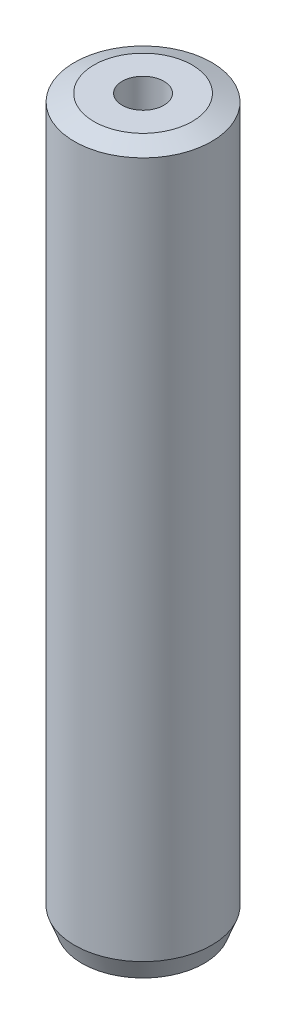
from build123d import *
from OCP.BRepFilletAPI import BRepFilletAPI_MakeChamfer

# Parameters (mm, degrees)
SKETCH1_R           = 42.5
BOSS_EXTRUDE1_DEPTH = 448.029516357
SKETCH2_R           = 12.921157366
CUT_EXTRUDE1_DEPTH  = 453.043081495
CHAMFER1_SIZE       = 4.660037963
CHAMFER1_SIZE2      = 12.087236707


with BuildPart() as part:
    # Sketch1 → Boss-Extrude1 (new body)
    with BuildSketch(Plane(origin=(0, 0, 0), x_dir=(1, 0, 0), z_dir=(0, 1, 0))):
        Circle(SKETCH1_R)
    extrude(amount=BOSS_EXTRUDE1_DEPTH)

    # Sketch2 → Cut-Extrude1 (cut, through all)
    with BuildSketch(Plane(origin=(0, 0, 0), x_dir=(1, 0, 0), z_dir=(0, 1, 0))):
        Circle(SKETCH2_R)
    extrude(amount=CUT_EXTRUDE1_DEPTH, mode=Mode.SUBTRACT)

    # Chamfer1: one chamfer whose edges measure the first distance from different faces: ONE call of the kernel's chamfer builder (chamfer() names one face for all edges)
    chamfer1_edges_1 = [part.edges().sort_by_distance(p)[0] for p in [
        (-42.5, 448.029516357, 0),
    ]]
    chamfer1_side_1 = [part.faces().sort_by_distance(p)[0] for p in [
        (-42.5, 224.014758179, 0),
    ]]
    chamfer1_edges_2 = [part.edges().sort_by_distance(p)[0] for p in [
        (-42.5, 0, 0),
    ]]
    chamfer1_side_2 = [part.faces().sort_by_distance(p)[0] for p in [
        (-41.297918472, 0, 0),
    ]]
    chamfer1 = BRepFilletAPI_MakeChamfer(part.part.solid().wrapped)
    for e in chamfer1_edges_1:
        chamfer1.Add(CHAMFER1_SIZE, CHAMFER1_SIZE2, e.wrapped, chamfer1_side_1[0].wrapped)  # the first distance lies on this face
    for e in chamfer1_edges_2:
        chamfer1.Add(CHAMFER1_SIZE, CHAMFER1_SIZE2, e.wrapped, chamfer1_side_2[0].wrapped)  # the first distance lies on this face
    add(Compound.cast(chamfer1.Shape()), mode=Mode.REPLACE)


solid = part.part
